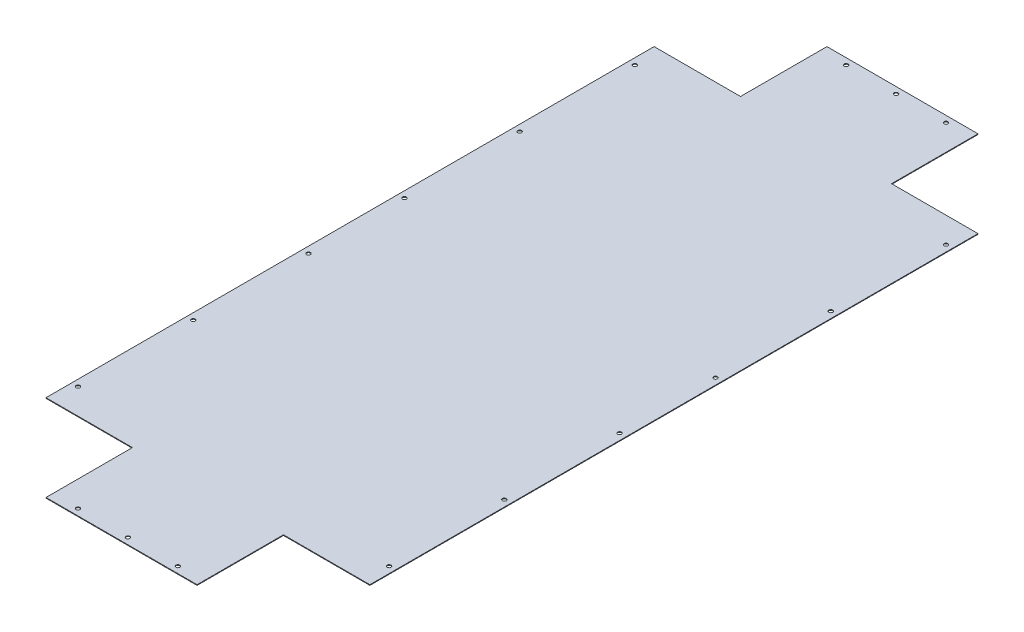
from build123d import *

# Parameters (mm, degrees)
BASE_FLANGE1_DEPTH = 1
SKETCH6_R          = 3
CUT_EXTRUDE1_DEPTH = 10


# Sheet-metal steps are written as plain solids
with BuildPart() as part:
    # Sketch1 → Base-Flange1 (new body)
    with BuildSketch(Plane(origin=(0, 0, 0), x_dir=(1, 0, 0), z_dir=(0, 1, 0))):
        Polygon((135, 0), (371, 0), (371, 135), (506, 135), (506, 1085), (371, 1085), (371, 1220), (135, 1220), (135, 1085), (0, 1085), (0, 135), (135, 135), align=None)
    extrude(amount=-BASE_FLANGE1_DEPTH)

    # Sketch6 → Cut-Extrude1 (cut)
    with BuildSketch(Plane(origin=(0, 0, 0), x_dir=(1, 0, 0), z_dir=(0, 1, 0))):
        with Locations(Location((496, 1045, 0), (0, 0, 270))):
            Circle(SKETCH6_R)
        with Locations(Location((496, 865, 0), (0, 0, 270))):
            Circle(SKETCH6_R)
        with Locations(Location((496, 685, 0), (0, 0, 270))):
            Circle(SKETCH6_R)
        with Locations(Location((331, 1210, 0), (0, 0, 270))):
            Circle(SKETCH6_R)
        with Locations(Location((175, 1210, 0), (0, 0, 270))):
            Circle(SKETCH6_R)
        with Locations(Location((10, 685, 0), (0, 0, 270))):
            Circle(SKETCH6_R)
        with Locations(Location((10, 865, 0), (0, 0, 270))):
            Circle(SKETCH6_R)
        with Locations(Location((10, 1045, 0), (0, 0, 270))):
            Circle(SKETCH6_R)
        with Locations(Location((253, 1209.997298013, 0), (0, 0, 270))):
            Circle(SKETCH6_R)
        with Locations(Location((253, 10.002701987, 0), (0, 0, 270))):
            Circle(SKETCH6_R)
        with Locations(Location((10, 175, 0), (0, 0, 270))):
            Circle(SKETCH6_R)
        with Locations(Location((10, 355, 0), (0, 0, 270))):
            Circle(SKETCH6_R)
        with Locations(Location((10, 535, 0), (0, 0, 270))):
            Circle(SKETCH6_R)
        with Locations(Location((175, 10, 0), (0, 0, 270))):
            Circle(SKETCH6_R)
        with Locations(Location((331, 10, 0), (0, 0, 270))):
            Circle(SKETCH6_R)
        with Locations(Location((496, 535, 0), (0, 0, 270))):
            Circle(SKETCH6_R)
        with Locations(Location((496, 355, 0), (0, 0, 270))):
            Circle(SKETCH6_R)
        with Locations(Location((496, 175, 0), (0, 0, 270))):
            Circle(SKETCH6_R)
    extrude(amount=-CUT_EXTRUDE1_DEPTH, mode=Mode.SUBTRACT)


solid = part.part
